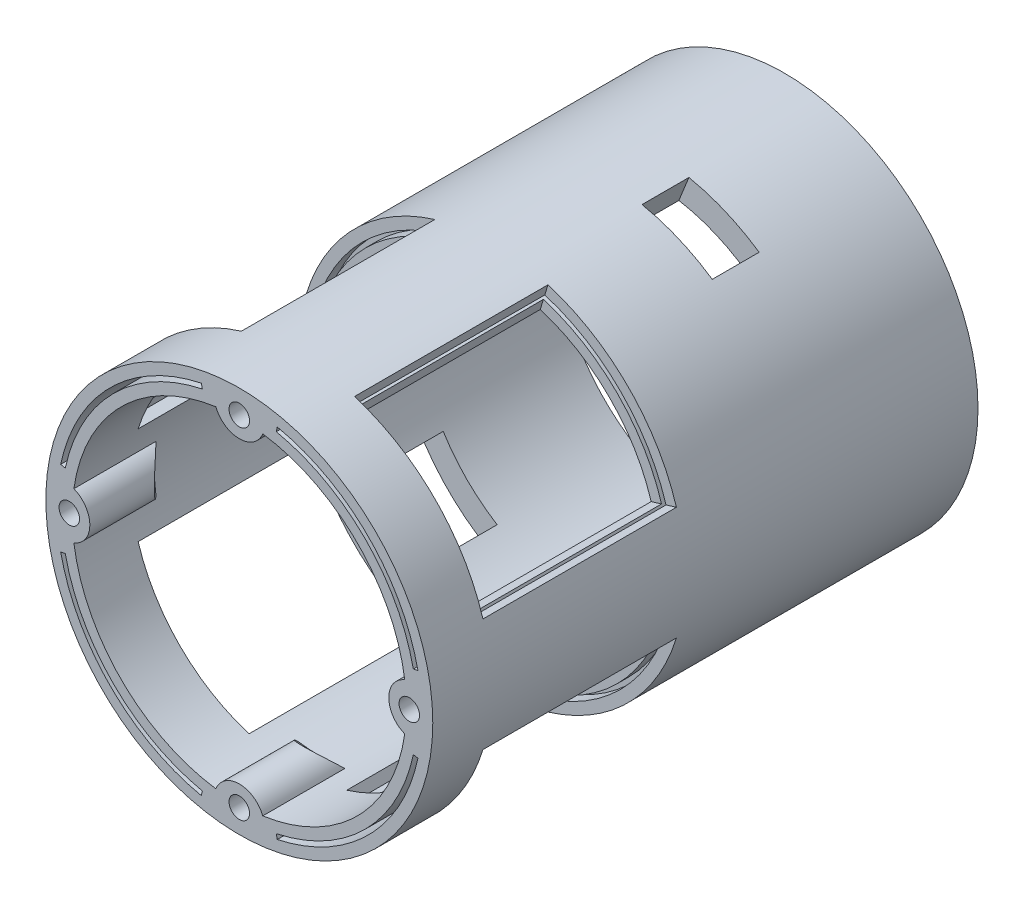
from build123d import *

# Parameters (mm, degrees)
CROQUIS1_R               = 33
CROQUIS1_R_2             = 28.5
BOSS_EXTRUDE1_DEPTH      = 93
CORTAR_EXTRUIR1_DEPTH    = 45
CROQUIS4_W               = 33
CROQUIS4_H               = 4.734026067
CORTAR_REVOLUCI_N2_ANGLE = 56
MATRIZC2_COUNT           = 4
BOSS_EXTRUDE4_DEPTH      = 11
SKETCH9_R                = 1.75
CUT_EXTRUDE3_DEPTH       = 10
SKETCH10_W               = 7
SKETCH10_H               = 15
SKETCH10_W_2             = 8
SKETCH10_H_2             = 13
CORTE_USB_Y_SWITCH_DEPTH = 10
SKETCH11_W               = 8
SKETCH11_H               = 13
CUT_EXTRUDE5_DEPTH       = 10
CHAMFER1_SIZE            = 3


with BuildPart() as part:
    # Croquis1 → Boss-Extrude1 (new body)
    with BuildSketch(Plane.XY):
        Circle(CROQUIS1_R)
        Circle(CROQUIS1_R_2, mode=Mode.SUBTRACT)
    extrude(amount=BOSS_EXTRUDE1_DEPTH)

    # Croquis2 → Cortar-Extruir1 (cut)
    with BuildSketch(Plane.XY.offset(93)):
        with BuildLine():
            Line((-30.469297763, -6.476449169), (-29.686779682, -6.310119816))
            ThreePointArc((-29.686779682, -6.310119816), (-21.460690809, -21.460690809), (-6.310119816, -29.686779682))
            Line((-6.310119816, -29.686779682), (-6.476449169, -30.469297763))
            ThreePointArc((-6.476449169, -30.469297763), (-22.026376234, -22.026376234), (-30.469297763, -6.476449169))
        make_face()
        with BuildLine():
            Line((-30.469297763, 6.476449169), (-29.686779682, 6.310119816))
            ThreePointArc((-29.686779682, 6.310119816), (-21.460690809, 21.460690809), (-6.310119816, 29.686779682))
            Line((-6.310119816, 29.686779682), (-6.476449169, 30.469297763))
            ThreePointArc((-6.476449169, 30.469297763), (-22.026376234, 22.026376234), (-30.469297763, 6.476449169))
        make_face()
        with BuildLine():
            Line((6.476449169, 30.469297763), (6.310119816, 29.686779682))
            ThreePointArc((6.310119816, 29.686779682), (21.460690809, 21.460690809), (29.686779682, 6.310119816))
            Line((29.686779682, 6.310119816), (30.469297763, 6.476449169))
            ThreePointArc((30.469297763, 6.476449169), (22.026376234, 22.026376234), (6.476449169, 30.469297763))
        make_face()
        with BuildLine():
            Line((30.469297763, -6.476449169), (29.686779682, -6.310119816))
            ThreePointArc((29.686779682, -6.310119816), (21.460690809, -21.460690809), (6.310119816, -29.686779682))
            Line((6.310119816, -29.686779682), (6.476449169, -30.469297763))
            ThreePointArc((6.476449169, -30.469297763), (22.026376234, -22.026376234), (30.469297763, -6.476449169))
        make_face()
    extrude(amount=-CORTAR_EXTRUIR1_DEPTH, mode=Mode.SUBTRACT)

    # Croquis4 → Cortar-Revolución2 (revolve, cut)
    with BuildSketch(Plane(origin=(0, 0, 0), x_dir=(0, 0, -1), z_dir=(0.9563047559630322, -0.29237170472274765, 0))):
        with Locations((-66.5, 30.632986966)):
            Rectangle(CROQUIS4_W, CROQUIS4_H)
    cortar_revoluci_n2 = revolve(axis=Axis((0, 0, 93), (0, 0, -1)), revolution_arc=CORTAR_REVOLUCI_N2_ANGLE, mode=Mode.SUBTRACT)

    # MatrizC2: Cortar-Revolución2 ×4 about axis
    matrizc2_axis = Axis((0, 0, 93), (0, 0, -1))
    for i in range(1, MATRIZC2_COUNT):
        add(cortar_revoluci_n2.rotate(matrizc2_axis, i * 360 / MATRIZC2_COUNT), mode=Mode.SUBTRACT)

    # Sketch8 → Boss-Extrude4 (add)
    with BuildSketch(Plane(origin=(0, 0, 0), x_dir=(-1, 0, 0), z_dir=(0, 0, -1))):
        with BuildLine():
            ThreePointArc((-4, -28.217902119), (0, -28.5), (4, -28.217902119))
            ThreePointArc((4, -28.217902119), (0, -25.495875503), (-4, -28.217902119))
        make_face()
        with BuildLine():
            ThreePointArc((-28.217902119, 4), (-28.5, 0), (-28.217902119, -4))
            ThreePointArc((-28.217902119, -4), (-25.495875503, 0), (-28.217902119, 4))
        make_face()
        with BuildLine():
            ThreePointArc((4, 28.217902119), (0, 28.5), (-4, 28.217902119))
            ThreePointArc((-4, 28.217902119), (0, 25.495875503), (4, 28.217902119))
        make_face()
        with BuildLine():
            ThreePointArc((28.217902119, -4), (28.5, 0), (28.217902119, 4))
            ThreePointArc((28.217902119, 4), (25.495875503, 0), (28.217902119, -4))
        make_face()
    boss_extrude4 = extrude(amount=-BOSS_EXTRUDE4_DEPTH)

    # Sketch9 → Cut-Extrude3 (cut)
    with BuildSketch(Plane(origin=(0, 0, 0), x_dir=(-1, 0, 0), z_dir=(0, 0, -1))):
        with Locations((0, -29)):
            Circle(SKETCH9_R)
        with Locations((-29, 0)):
            Circle(SKETCH9_R)
        with Locations((0, 29)):
            Circle(SKETCH9_R)
        with Locations((29, 0)):
            Circle(SKETCH9_R)
    cut_extrude3 = extrude(amount=-CUT_EXTRUDE3_DEPTH, mode=Mode.SUBTRACT)

    # Mirror1: Boss-Extrude4, Cut-Extrude3 across plane
    add(boss_extrude4.mirror(Plane.XY.offset(46.5)))
    add(cut_extrude3.mirror(Plane.XY.offset(46.5)), mode=Mode.SUBTRACT)

    # Sketch10 → Corte USB y Switch (cut)
    with BuildSketch(Plane(origin=(-23.334523779, -23.334523779, 0), x_dir=(0, 0, -1), z_dir=(-0.7071067811865488, -0.7071067811865464, 0))):
        with Locations((-7, 0)):
            Rectangle(SKETCH10_W, SKETCH10_H)
        with Locations((-38, 0)):
            Rectangle(SKETCH10_W_2, SKETCH10_H_2)
    extrude(amount=-CORTE_USB_Y_SWITCH_DEPTH, mode=Mode.SUBTRACT)

    # Sketch11 → Cut-Extrude5 (cut)
    with BuildSketch(Plane(origin=(12.362017583, 30.597067201, 0), x_dir=(0, 0, -1), z_dir=(0.37460659341590646, 0.9271838545667896, 0))):
        with Locations((-26.9, -0.5)):
            Rectangle(SKETCH11_W, SKETCH11_H)
    extrude(amount=-CUT_EXTRUDE5_DEPTH, mode=Mode.SUBTRACT)

    # Chamfer1
    chamfer1_edges = [part.edges().sort_by_distance(p)[0] for p in [
        (0, 28.5, 82),
        (-28.5, 0, 82),
        (28.429388055, -2.004967532, 82),
        (0, -28.5, 82),
    ]]
    chamfer(chamfer1_edges, length=CHAMFER1_SIZE)


solid = part.part
